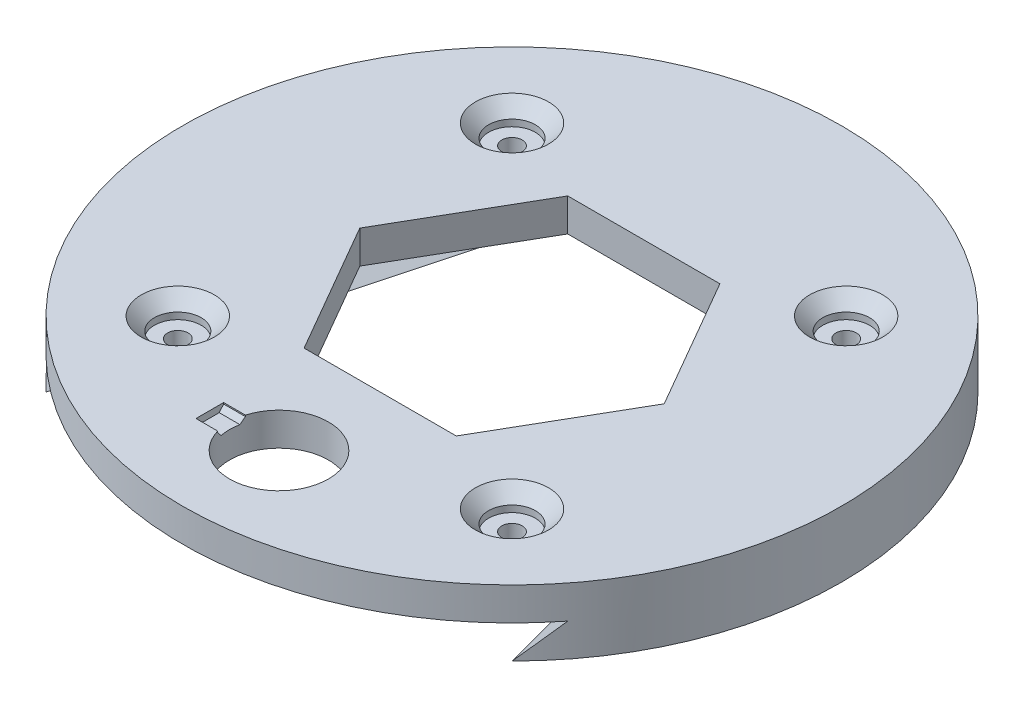
from build123d import *

# Parameters (mm, degrees)
SKETCH1_R                   = 50
BOSS_EXTRUDE1_DEPTH         = 5
BOSS_EXTRUDE2_START         = -5
BOSS_EXTRUDE2_DEPTH         = 5
DRAFT1_ANGLE                = -45
CUT_EXTRUDE2_DEPTH          = 71.887234394
CUT_EXTRUDE2_DEPTH_BACK     = 71.887234394
SKETCH1_8_R                 = 7.5
CUT_EXTRUDE3_DEPTH          = 71.887234394
SKETCH3_R                   = 3.55
SKETCH3_R_2                 = 1.55
CUT_EXTRUDE4_DEPTH          = 3
SKETCH3_3_R                 = 1.55
CUT_EXTRUDE6_DEPTH          = 72.414284285
CHAMFER1_SIZE               = 2
CUT_EXTRUDE7_3_RADIUS_DEPTH = 10.5


with BuildPart() as part:
    # Sketch1 → Boss-Extrude1 (new body)
    with BuildSketch(Plane(origin=(0, 0, 0), x_dir=(1, 0, 0), z_dir=(0, 1, 0))):
        Circle(SKETCH1_R)
    extrude(amount=BOSS_EXTRUDE1_DEPTH)

    # Sketch1<5> → Boss-Extrude2 (add)
    with BuildSketch(Plane(origin=(0, 0, 0), x_dir=(1, 0, 0), z_dir=(0, 1, 0)).offset(BOSS_EXTRUDE2_START)):
        with BuildLine():
            ThreePointArc((-12.940952255, 48.296291314), (-48.296291314, 12.940952255), (-35.355339059, -35.355339059))
            Line((-35.355339059, -35.355339059), (-12.940952255, 48.296291314))
        make_face()
        with BuildLine():
            Line((12.940952255, 48.296291314), (35.355339059, -35.355339059))
            ThreePointArc((35.355339059, -35.355339059), (48.296291314, 12.940952255), (12.940952255, 48.296291314))
        make_face()
    extrude(amount=BOSS_EXTRUDE2_DEPTH)

    # Draft1
    draft1_faces = [part.faces().sort_by_distance(p)[0] for p in [
        (24.148145657, -2.5, -6.470476128),
        (-24.148145657, -2.5, -6.470476128),
    ]]
    draft(draft1_faces, Plane(origin=(0, -5, 0), x_dir=(0, 0, -1), z_dir=(0, -1, 0)), DRAFT1_ANGLE)

    # Sketch1<8> → Cut-Extrude2 (cut, two sides: drawn at the far end of the back side and taken through both)
    with BuildSketch(Plane(origin=(0, 0, 0), x_dir=(1, 0, 0), z_dir=(0, 1, 0)).offset(-CUT_EXTRUDE2_DEPTH_BACK)):
        with Locations((0, -35.355339059)):
            Circle(SKETCH1_8_R)
    extrude(amount=CUT_EXTRUDE2_DEPTH + CUT_EXTRUDE2_DEPTH_BACK, mode=Mode.SUBTRACT)

    # Sketch2 → Cut-Extrude3 (cut, through all)
    with BuildSketch(Plane.XZ):
        Polygon((23.094010768, 0), (11.547005384, 20), (-11.547005384, 20), (-23.094010768, 0), (-11.547005384, -20), (11.547005384, -20), align=None)
    extrude(amount=-CUT_EXTRUDE3_DEPTH, mode=Mode.SUBTRACT)

    # Sketch3 → Cut-Extrude4 (cut)
    # profile 1 of 4: a face of its own
    with BuildSketch(Plane(origin=(0, 5, 0), x_dir=(1, 0, 0), z_dir=(0, 1, 0))):
        with Locations((-25.355339059, 25.355339059)):
            Circle(SKETCH3_R)
        with Locations((-25.355339059, 25.355339059)):
            Circle(SKETCH3_R_2, mode=Mode.SUBTRACT)
    # profile 2 of 4: a face of its own
    with BuildSketch(Plane(origin=(0, 5, 0), x_dir=(1, 0, 0), z_dir=(0, 1, 0))):
        with Locations((25.355339059, 25.355339059)):
            Circle(SKETCH3_R)
        with Locations((25.355339059, 25.355339059)):
            Circle(SKETCH3_R_2, mode=Mode.SUBTRACT)
    # profile 3 of 4: a face of its own
    with BuildSketch(Plane(origin=(0, 5, 0), x_dir=(1, 0, 0), z_dir=(0, 1, 0))):
        with Locations((25.355339059, -25.355339059)):
            Circle(SKETCH3_R)
        with Locations((25.355339059, -25.355339059)):
            Circle(SKETCH3_R_2, mode=Mode.SUBTRACT)
    # profile 4 of 4: a face of its own
    with BuildSketch(Plane(origin=(0, 5, 0), x_dir=(1, 0, 0), z_dir=(0, 1, 0))):
        with Locations((-25.355339059, -25.355339059)):
            Circle(SKETCH3_R)
        with Locations((-25.355339059, -25.355339059)):
            Circle(SKETCH3_R_2, mode=Mode.SUBTRACT)
    extrude(amount=-CUT_EXTRUDE4_DEPTH, mode=Mode.SUBTRACT)

    # Sketch3<3> → Cut-Extrude6 (cut, through all)
    with BuildSketch(Plane(origin=(0, 5, 0), x_dir=(1, 0, 0), z_dir=(0, 1, 0))):
        with Locations((-25.355339059, 25.355339059)):
            Circle(SKETCH3_3_R)
        with Locations((25.355339059, 25.355339059)):
            Circle(SKETCH3_3_R)
        with Locations((25.355339059, -25.355339059)):
            Circle(SKETCH3_3_R)
        with Locations((-25.355339059, -25.355339059)):
            Circle(SKETCH3_3_R)
    extrude(amount=-CUT_EXTRUDE6_DEPTH, mode=Mode.SUBTRACT)

    # Chamfer1
    chamfer1_edges = [part.edges().sort_by_distance(p)[0] for p in [
        (21.805339059, 5, -25.355339059),
        (-28.905339059, 5, -25.355339059),
        (-28.905339059, 5, 25.355339059),
        (21.805339059, 5, 25.355339059),
    ]]
    chamfer(chamfer1_edges, length=CHAMFER1_SIZE)

    # Sketch4 → Cut-Extrude7 - 3 + radius (cut)
    with BuildSketch(Plane(origin=(0, 0, 0), x_dir=(0, 0, -1), z_dir=(1, 0, 0))):
        Polygon((-37.455339059, 5.6), (-33.255339059, 5.6), (-33.255339059, 4.8), (-33.926618764, 4), (-36.784059354, 4), (-37.455339059, 4.8), align=None)
    extrude(amount=-CUT_EXTRUDE7_3_RADIUS_DEPTH, mode=Mode.SUBTRACT)


solid = part.part
